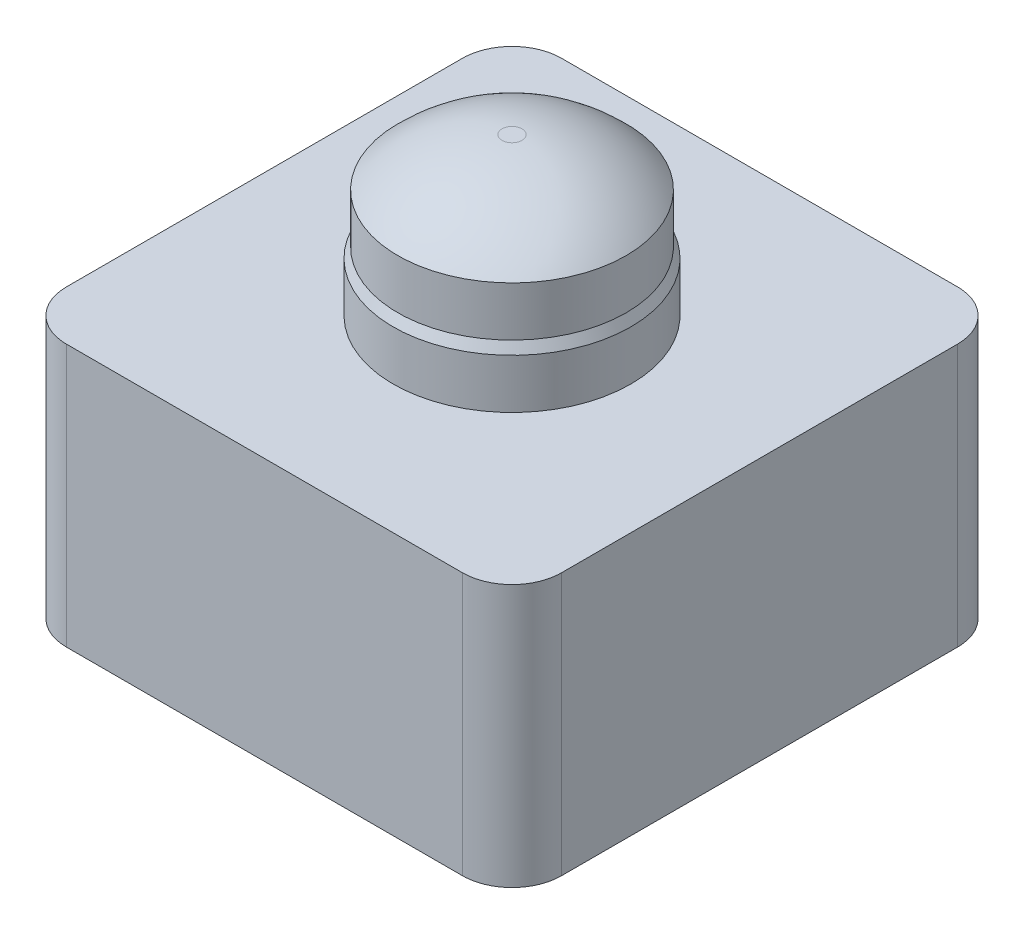
from build123d import *

# Parameters (mm, degrees)
SKETCH3_W           = 50
SKETCH3_H           = 50
BOSS_EXTRUDE1_DEPTH = 26.5
SKETCH4_R           = 1.5
CUT_EXTRUDE1_DEPTH  = 7.5
VARFILLET1_START    = -1
VARFILLET1_DEPTH    = 28


with BuildPart() as part:
    # Sketch3 → Boss-Extrude1 (new body)
    with BuildSketch(Plane(origin=(0, 0, 0), x_dir=(1, 0, 0), z_dir=(0, 1, 0))):
        Rectangle(SKETCH3_W, SKETCH3_H)
    extrude(amount=BOSS_EXTRUDE1_DEPTH)

    # Sketch4 → Cut-Extrude1 (cut)
    with BuildSketch(Plane(origin=(0, 0, 0), x_dir=(1, 0, 0), z_dir=(0, 1, 0))):
        with Locations(Location((22.000213283, 22.000213283, 0), (0, 0, 270))):
            Circle(SKETCH4_R)
        with Locations(Location((22.000213283, -22.000213283, 0), (0, 0, 270))):
            Circle(SKETCH4_R)
        with Locations(Location((-22.000213283, -22.000213283, 0), (0, 0, 270))):
            Circle(SKETCH4_R)
        with Locations(Location((-22.000213283, 22.000213283, 0), (0, 0, 270))):
            Circle(SKETCH4_R)
    extrude(amount=CUT_EXTRUDE1_DEPTH, mode=Mode.SUBTRACT)

    # Sketch6 → Revolve1 (revolve)
    with BuildSketch(Plane.XY):
        with BuildLine():
            Line((0, 42.32), (0, 26.5))
            Line((0, 26.5), (12, 26.5))
            Line((12, 26.5), (12, 31.5))
            Line((12, 31.5), (11.530705563, 32.5))
            Line((11.530705563, 32.5), (11.530705563, 37.5))
            ThreePointArc((11.530705563, 37.5), (6.71772817, 40.886032515), (1.010390364, 42.32))
            Line((1.010390364, 42.32), (0, 42.32))
        make_face()
    revolve(axis=Axis((0, 26.5, 0), (0, 1, 0)))

    # VarFillet1: read off the stored shape, not the designer's step
    # VarFillet1 outline → VarFillet1 (cut)
    with BuildSketch(Plane(origin=(0, 0, 0), x_dir=(1, 0, 0), z_dir=(0, 1, 0)).offset(VARFILLET1_START)):
        with BuildLine():
            Line((-25, -25), (-20, -25))
            add(Edge.make_bspline(
                [(-20, -25), (-25, -25), (-25, -20)],
                knots=[0, 0, 0, 1, 1, 1], degree=2, weights=[1, 0.707106781, 1]))
            Line((-25, -20), (-25, -25))
        make_face()
        with BuildLine():
            add(Edge.make_bspline(
                [(25, -20), (25, -25), (20, -25)],
                knots=[0, 0, 0, 1, 1, 1], degree=2, weights=[1, 0.707106781, 1]))
            Line((20, -25), (25, -25))
            Line((25, -25), (25, -20))
        make_face()
        with BuildLine():
            Line((-25, 25), (-25, 20))
            add(Edge.make_bspline(
                [(-25, 20), (-25, 25), (-20, 25)],
                knots=[0, 0, 0, 1, 1, 1], degree=2, weights=[1, 0.707106781, 1]))
            Line((-20, 25), (-25, 25))
        make_face()
        with BuildLine():
            add(Edge.make_bspline(
                [(20, 25), (25, 25), (25, 20)],
                knots=[0, 0, 0, 1, 1, 1], degree=2, weights=[1, 0.707106781, 1]))
            Line((25, 20), (25, 25))
            Line((25, 25), (20, 25))
        make_face()
    extrude(amount=VARFILLET1_DEPTH, mode=Mode.SUBTRACT)


solid = part.part
